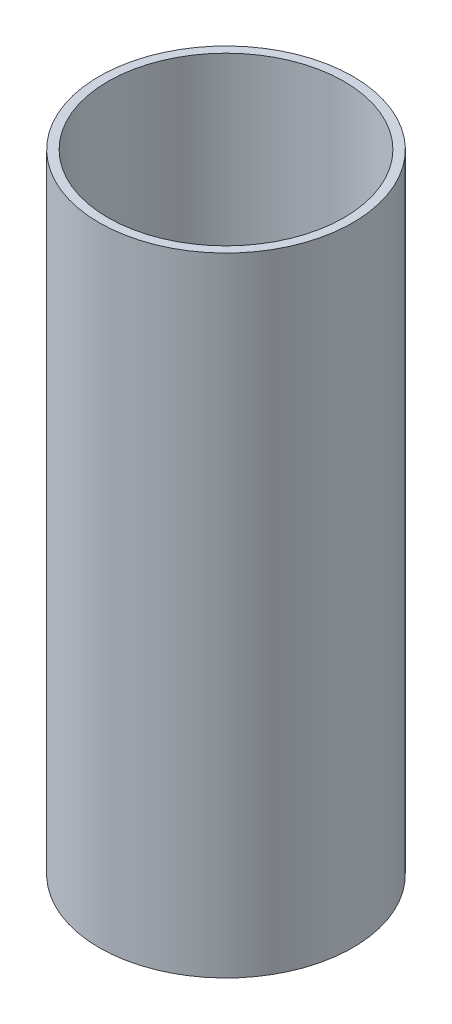
from build123d import *

# Parameters (mm, degrees)
SKETCH1_W = 1.4224
SKETCH1_H = 101.6


with BuildPart() as part:
    # Sketch1 → Revolve1 (revolve)
    with BuildSketch(Plane.XY):
        with Locations((-19.812, 279.4)):
            Rectangle(SKETCH1_W, SKETCH1_H)
    revolve(axis=Axis((0, 0, 0), (0, 1, 0)))


solid = part.part
